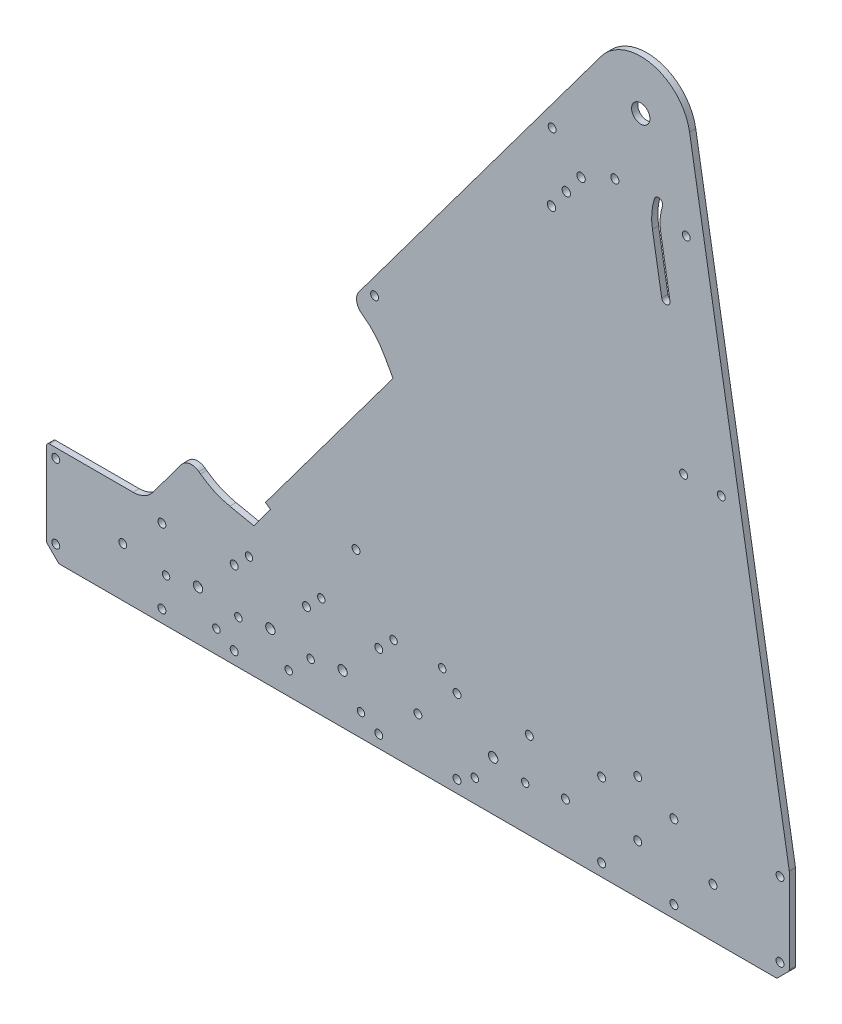
from build123d import *

# Parameters (mm, degrees)
BOSS_EXTRUDE1_DEPTH = 3.175
CUT_EXTRUDE1_REACH  = 536.354
SKETCH2_R           = 2.032
SKETCH5_R           = 2.032
SKETCH5_R_2         = 2.38125
CUT_EXTRUDE4_DEPTH  = 535.353537581
SKETCH6_R           = 2.032
CUT_EXTRUDE5_DEPTH  = 535.353537581
SKETCH3_R           = 4.699
SKETCH3_R_2         = 2.032
SKETCH3_R_3         = 2.0955
SKETCH3_R_4         = 2.159
CUT_EXTRUDE2_DEPTH  = 535.353537581
FILLET1_R           = 1.5875
CUT_EXTRUDE3_REACH  = 536.354
SKETCH4_R           = 1.905
FILLET2_R           = 38.1
FILLET3_R           = 6.35


with BuildPart() as part:
    # Sketch1 → Boss-Extrude1 (new body)
    with BuildSketch(Plane.XY):
        with BuildLine():
            Line((0, 0), (381, 0))
            Line((381, 0), (381, 50.8))
            Line((381, 50.8), (329.844840527, 353.482725241))
            ThreePointArc((329.844840527, 353.482725241), (310.749161823, 373.943470262), (284.430621647, 364.423939024))
            Line((284.430621647, 364.423939024), (156.481664632, 192.666249))
            Line((156.481664632, 192.666249), (169.212526103, 183.18253711))
            Line((169.212526103, 183.18253711), (177.742147454, 168.059112986))
            Line((177.742147454, 168.059112986), (112.328856621, 80.248817439))
            Line((112.328856621, 80.248817439), (114.875028915, 78.352075061))
            Line((114.875028915, 78.352075061), (106.339688214, 66.894299738))
            Line((106.339688214, 66.894299738), (85.755861471, 71.150956167))
            Line((85.755861471, 71.150956167), (73.025, 80.634668057))
            Line((73.025, 80.634668057), (54.608894484, 55.913030488))
            ThreePointArc((54.608894484, 55.913030488), (50.122252657, 52.150010731), (44.424205307, 50.8))
            Line((44.424205307, 50.8), (0, 50.8))
            Line((0, 50.8), (0, 0))
        make_face()
    extrude(amount=BOSS_EXTRUDE1_DEPTH)

    # Sketch2 → Cut-Extrude1 (cut, up to next)
    with BuildSketch(Plane.XY.offset(3.175), mode=Mode.PRIVATE) as cut_extrude1_sk1:
        with Locations((4.7625, 46.0375)):
            Circle(SKETCH2_R)
    cut_extrude1_tool1 = extrude(cut_extrude1_sk1.sketch, amount=-CUT_EXTRUDE1_REACH, mode=Mode.PRIVATE) & part.part
    # Sketch2 → Cut-Extrude1 (cut, up to next)
    with BuildSketch(Plane.XY.offset(3.175), mode=Mode.PRIVATE) as cut_extrude1_sk2:
        with Locations((4.7625, 7.9375)):
            Circle(SKETCH2_R)
    cut_extrude1_tool2 = extrude(cut_extrude1_sk2.sketch, amount=-CUT_EXTRUDE1_REACH, mode=Mode.PRIVATE) & part.part
    # Sketch2 → Cut-Extrude1 (cut, up to next)
    with BuildSketch(Plane.XY.offset(3.175), mode=Mode.PRIVATE) as cut_extrude1_sk3:
        with Locations((376.2375, 7.9375)):
            Circle(SKETCH2_R)
    cut_extrude1_tool3 = extrude(cut_extrude1_sk3.sketch, amount=-CUT_EXTRUDE1_REACH, mode=Mode.PRIVATE) & part.part
    # Sketch2 → Cut-Extrude1 (cut, up to next)
    with BuildSketch(Plane.XY.offset(3.175), mode=Mode.PRIVATE) as cut_extrude1_sk4:
        with Locations((376.2375, 46.0375)):
            Circle(SKETCH2_R)
    cut_extrude1_tool4 = extrude(cut_extrude1_sk4.sketch, amount=-CUT_EXTRUDE1_REACH, mode=Mode.PRIVATE) & part.part
    # Sketch2 → Cut-Extrude1 (cut, up to next)
    with BuildSketch(Plane.XY.offset(3.175), mode=Mode.PRIVATE) as cut_extrude1_sk5:
        Polygon((0, 6.35), (0, 0), (6.35, 0), align=None)
    cut_extrude1_tool5 = extrude(cut_extrude1_sk5.sketch, amount=-CUT_EXTRUDE1_REACH, mode=Mode.PRIVATE) & part.part
    # Sketch2 → Cut-Extrude1 (cut, up to next)
    with BuildSketch(Plane.XY.offset(3.175), mode=Mode.PRIVATE) as cut_extrude1_sk6:
        Polygon((381, 0), (374.65, 0), (381, 6.35), align=None)
    cut_extrude1_tool6 = extrude(cut_extrude1_sk6.sketch, amount=-CUT_EXTRUDE1_REACH, mode=Mode.PRIVATE) & part.part
    add(cut_extrude1_tool1.solids().sort_by_distance((4.7625, 46.0375, 3.175))[0], mode=Mode.SUBTRACT)
    add(cut_extrude1_tool2.solids().sort_by_distance((4.7625, 7.9375, 3.175))[0], mode=Mode.SUBTRACT)
    add(cut_extrude1_tool3.solids().sort_by_distance((376.2375, 7.9375, 3.175))[0], mode=Mode.SUBTRACT)
    add(cut_extrude1_tool4.solids().sort_by_distance((376.2375, 46.0375, 3.175))[0], mode=Mode.SUBTRACT)
    add(cut_extrude1_tool5.solids().sort_by_distance((2.116667, 2.116667, 3.175))[0], mode=Mode.SUBTRACT)
    add(cut_extrude1_tool6.solids().sort_by_distance((378.883333, 2.116667, 3.175))[0], mode=Mode.SUBTRACT)

    # Sketch5 → Cut-Extrude4 (cut, through all)
    with BuildSketch(Plane.XY.offset(3.175)):
        with Locations((39.116, 25.4)):
            Circle(SKETCH5_R)
        with Locations((59.182, 6.35)):
            Circle(SKETCH5_R)
        with Locations((59.182, 44.45)):
            Circle(SKETCH5_R)
        with Locations((96.266, 44.45)):
            Circle(SKETCH5_R)
        with Locations((133.35, 44.45)):
            Circle(SKETCH5_R)
        with Locations((170.434, 44.45)):
            Circle(SKETCH5_R)
        with Locations((210.566, 44.45)):
            Circle(SKETCH5_R)
        with Locations((210.566, 6.35)):
            Circle(SKETCH5_R)
        with Locations((170.434, 6.35)):
            Circle(SKETCH5_R)
        with Locations((247.65, 44.45)):
            Circle(SKETCH5_R)
        with Locations((266.192, 25.4)):
            Circle(SKETCH5_R)
        with Locations((77.724, 25.4)):
            Circle(SKETCH5_R_2)
        with Locations((114.808, 25.4)):
            Circle(SKETCH5_R_2)
        with Locations((151.892, 25.4)):
            Circle(SKETCH5_R_2)
        with Locations((229.108, 25.4)):
            Circle(SKETCH5_R_2)
        with Locations((190.5, 25.4)):
            Circle(SKETCH5_R)
        with Locations((303.276, 25.4)):
            Circle(SKETCH5_R)
        with Locations((341.884, 25.4)):
            Circle(SKETCH5_R)
    extrude(amount=-CUT_EXTRUDE4_DEPTH, mode=Mode.SUBTRACT)

    # Sketch6 → Cut-Extrude5 (cut, through all)
    with BuildSketch(Plane.XY.offset(3.175)):
        with Locations((284.734, 44.45)):
            Circle(SKETCH6_R)
        with Locations((284.734, 6.35)):
            Circle(SKETCH6_R)
        with Locations((321.818, 6.35)):
            Circle(SKETCH6_R)
        with Locations((321.818, 44.45)):
            Circle(SKETCH6_R)
        with Locations((96.266, 6.35)):
            Circle(SKETCH6_R)
        with Locations((303.276, 53.975)):
            Circle(SKETCH6_R)
    extrude(amount=-CUT_EXTRUDE5_DEPTH, mode=Mode.SUBTRACT)

    # Sketch3 → Cut-Extrude2 (cut, through all)
    with BuildSketch(Plane.XY.offset(3.175)):
        with Locations((304.8, 349.25)):
            Circle(SKETCH3_R)
        with Locations((168.275, 200.025)):
            Circle(SKETCH3_R_2)
        with Locations((158.75, 82.55)):
            Circle(SKETCH3_R_2)
        with Locations((291.514840983, 313.541253874)):
            Circle(SKETCH3_R_3)
        with Locations((274.192879702, 305.613318622)):
            Circle(SKETCH3_R_4)
        with Locations((266.60591019, 295.428629445)):
            Circle(SKETCH3_R_4)
        with Locations((259.018940678, 285.243940269)):
            Circle(SKETCH3_R_4)
        with Locations((328.130942222, 306.465572241)):
            Circle(SKETCH3_R_2)
        with Locations((346.120024496, 200.025)):
            Circle(SKETCH3_R_2)
        with Locations((259.353431816, 320.131104669)):
            Circle(SKETCH3_R_2)
        with Locations((326.799877519, 200.025)):
            Circle(SKETCH3_R_2)
        with BuildLine():
            Line((315.549436393, 272.690218355), (310.803177504, 300.773613851))
            ThreePointArc((310.803177504, 300.773613851), (310.471072242, 307.95118062), (311.87134524, 314.998662025))
            ThreePointArc((311.87134524, 314.998662025), (314.59621678, 316.376209515), (315.97376427, 313.651337975))
            ThreePointArc((315.97376427, 313.651337975), (314.776949743, 307.627849594), (315.060800394, 301.493177142))
            Line((315.060800394, 301.493177142), (319.807059282, 273.409781645))
            ThreePointArc((319.807059282, 273.409781645), (318.038029483, 270.921188555), (315.549436393, 272.690218355))
        make_face()
    extrude(amount=-CUT_EXTRUDE2_DEPTH, mode=Mode.SUBTRACT)

    # Fillet1
    fillet1_edges = [part.edges().sort_by_distance(p)[0] for p in [
        (374.65, 0, 1.5875),
        (381, 6.35, 1.5875),
        (381, 50.8, 1.5875),
        (6.35, 0, 1.5875),
        (0, 6.35, 1.5875),
        (0, 50.8, 1.5875),
    ]]
    fillet(fillet1_edges, radius=FILLET1_R)

    # Sketch4 → Cut-Extrude3 (cut, up to next)
    with BuildSketch(Plane(origin=(0, 0, 0), x_dir=(-1, 0, 0), z_dir=(0, 0, -1)), mode=Mode.PRIVATE) as cut_extrude3_sk1:
        with Locations((-61.318145625, 22.298133105)):
            Circle(SKETCH4_R)
    cut_extrude3_tool1 = extrude(cut_extrude3_sk1.sketch, amount=-CUT_EXTRUDE3_REACH, mode=Mode.PRIVATE) & part.part
    # Sketch4 → Cut-Extrude3 (cut, up to next)
    with BuildSketch(Plane(origin=(0, 0, 0), x_dir=(-1, 0, 0), z_dir=(0, 0, -1)), mode=Mode.PRIVATE) as cut_extrude3_sk2:
        with Locations((-87.131339764, 11.605958005)):
            Circle(SKETCH4_R)
    cut_extrude3_tool2 = extrude(cut_extrude3_sk2.sketch, amount=-CUT_EXTRUDE3_REACH, mode=Mode.PRIVATE) & part.part
    # Sketch4 → Cut-Extrude3 (cut, up to next)
    with BuildSketch(Plane(origin=(0, 0, 0), x_dir=(-1, 0, 0), z_dir=(0, 0, -1)), mode=Mode.PRIVATE) as cut_extrude3_sk3:
        with Locations((-98.402145625, 22.298133105)):
            Circle(SKETCH4_R)
    cut_extrude3_tool3 = extrude(cut_extrude3_sk3.sketch, amount=-CUT_EXTRUDE3_REACH, mode=Mode.PRIVATE) & part.part
    # Sketch4 → Cut-Extrude3 (cut, up to next)
    with BuildSketch(Plane(origin=(0, 0, 0), x_dir=(-1, 0, 0), z_dir=(0, 0, -1)), mode=Mode.PRIVATE) as cut_extrude3_sk4:
        with Locations((-124.215339764, 11.605958005)):
            Circle(SKETCH4_R)
    cut_extrude3_tool4 = extrude(cut_extrude3_sk4.sketch, amount=-CUT_EXTRUDE3_REACH, mode=Mode.PRIVATE) & part.part
    # Sketch4 → Cut-Extrude3 (cut, up to next)
    with BuildSketch(Plane(origin=(0, 0, 0), x_dir=(-1, 0, 0), z_dir=(0, 0, -1)), mode=Mode.PRIVATE) as cut_extrude3_sk5:
        with Locations((-135.486145625, 22.298133105)):
            Circle(SKETCH4_R)
    cut_extrude3_tool5 = extrude(cut_extrude3_sk5.sketch, amount=-CUT_EXTRUDE3_REACH, mode=Mode.PRIVATE) & part.part
    # Sketch4 → Cut-Extrude3 (cut, up to next)
    with BuildSketch(Plane(origin=(0, 0, 0), x_dir=(-1, 0, 0), z_dir=(0, 0, -1)), mode=Mode.PRIVATE) as cut_extrude3_sk6:
        with Locations((-161.299339764, 11.605958005)):
            Circle(SKETCH4_R)
    cut_extrude3_tool6 = extrude(cut_extrude3_sk6.sketch, amount=-CUT_EXTRUDE3_REACH, mode=Mode.PRIVATE) & part.part
    # Sketch4 → Cut-Extrude3 (cut, up to next)
    with BuildSketch(Plane(origin=(0, 0, 0), x_dir=(-1, 0, 0), z_dir=(0, 0, -1)), mode=Mode.PRIVATE) as cut_extrude3_sk7:
        with Locations((-245.513854375, 22.298133105)):
            Circle(SKETCH4_R)
    cut_extrude3_tool7 = extrude(cut_extrude3_sk7.sketch, amount=-CUT_EXTRUDE3_REACH, mode=Mode.PRIVATE) & part.part
    # Sketch4 → Cut-Extrude3 (cut, up to next)
    with BuildSketch(Plane(origin=(0, 0, 0), x_dir=(-1, 0, 0), z_dir=(0, 0, -1)), mode=Mode.PRIVATE) as cut_extrude3_sk8:
        with Locations((-219.700660236, 11.605958005)):
            Circle(SKETCH4_R)
    cut_extrude3_tool8 = extrude(cut_extrude3_sk8.sketch, amount=-CUT_EXTRUDE3_REACH, mode=Mode.PRIVATE) & part.part
    # Sketch4 → Cut-Extrude3 (cut, up to next)
    with BuildSketch(Plane(origin=(0, 0, 0), x_dir=(-1, 0, 0), z_dir=(0, 0, -1)), mode=Mode.PRIVATE) as cut_extrude3_sk9:
        with Locations((-202.981986443, 51.968407021)):
            Circle(SKETCH4_R)
    cut_extrude3_tool9 = extrude(cut_extrude3_sk9.sketch, amount=-CUT_EXTRUDE3_REACH, mode=Mode.PRIVATE) & part.part
    # Sketch4 → Cut-Extrude3 (cut, up to next)
    with BuildSketch(Plane(origin=(0, 0, 0), x_dir=(-1, 0, 0), z_dir=(0, 0, -1)), mode=Mode.PRIVATE) as cut_extrude3_sk10:
        with Locations((-178.018013557, 51.968407021)):
            Circle(SKETCH4_R)
    cut_extrude3_tool10 = extrude(cut_extrude3_sk10.sketch, amount=-CUT_EXTRUDE3_REACH, mode=Mode.PRIVATE) & part.part
    # Sketch4 → Cut-Extrude3 (cut, up to next)
    with BuildSketch(Plane(origin=(0, 0, 0), x_dir=(-1, 0, 0), z_dir=(0, 0, -1)), mode=Mode.PRIVATE) as cut_extrude3_sk11:
        with Locations((-140.934013557, 51.968407021)):
            Circle(SKETCH4_R)
    cut_extrude3_tool11 = extrude(cut_extrude3_sk11.sketch, amount=-CUT_EXTRUDE3_REACH, mode=Mode.PRIVATE) & part.part
    # Sketch4 → Cut-Extrude3 (cut, up to next)
    with BuildSketch(Plane(origin=(0, 0, 0), x_dir=(-1, 0, 0), z_dir=(0, 0, -1)), mode=Mode.PRIVATE) as cut_extrude3_sk12:
        with Locations((-103.850013557, 51.968407021)):
            Circle(SKETCH4_R)
    cut_extrude3_tool12 = extrude(cut_extrude3_sk12.sketch, amount=-CUT_EXTRUDE3_REACH, mode=Mode.PRIVATE) & part.part
    add(cut_extrude3_tool1.solids().sort_by_distance((61.318146, 22.298133, 0))[0], mode=Mode.SUBTRACT)
    add(cut_extrude3_tool2.solids().sort_by_distance((87.13134, 11.605958, 0))[0], mode=Mode.SUBTRACT)
    add(cut_extrude3_tool3.solids().sort_by_distance((98.402146, 22.298133, 0))[0], mode=Mode.SUBTRACT)
    add(cut_extrude3_tool4.solids().sort_by_distance((124.21534, 11.605958, 0))[0], mode=Mode.SUBTRACT)
    add(cut_extrude3_tool5.solids().sort_by_distance((135.486146, 22.298133, 0))[0], mode=Mode.SUBTRACT)
    add(cut_extrude3_tool6.solids().sort_by_distance((161.29934, 11.605958, 0))[0], mode=Mode.SUBTRACT)
    add(cut_extrude3_tool7.solids().sort_by_distance((245.513854, 22.298133, 0))[0], mode=Mode.SUBTRACT)
    add(cut_extrude3_tool8.solids().sort_by_distance((219.70066, 11.605958, 0))[0], mode=Mode.SUBTRACT)
    add(cut_extrude3_tool9.solids().sort_by_distance((202.981986, 51.968407, 0))[0], mode=Mode.SUBTRACT)
    add(cut_extrude3_tool10.solids().sort_by_distance((178.018014, 51.968407, 0))[0], mode=Mode.SUBTRACT)
    add(cut_extrude3_tool11.solids().sort_by_distance((140.934014, 51.968407, 0))[0], mode=Mode.SUBTRACT)
    add(cut_extrude3_tool12.solids().sort_by_distance((103.850014, 51.968407, 0))[0], mode=Mode.SUBTRACT)

    # Fillet2
    fillet2_edges = [part.edges().sort_by_distance(p)[0] for p in [
        (85.755861471, 71.150956167, 1.5875),
        (169.212526103, 183.18253711, 1.5875),
    ]]
    fillet(fillet2_edges, radius=FILLET2_R)

    # Fillet3
    fillet3_edges = [part.edges().sort_by_distance(p)[0] for p in [
        (73.025, 80.634668057, 1.5875),
        (156.481664632, 192.666249, 1.5875),
    ]]
    fillet(fillet3_edges, radius=FILLET3_R)


solid = part.part
